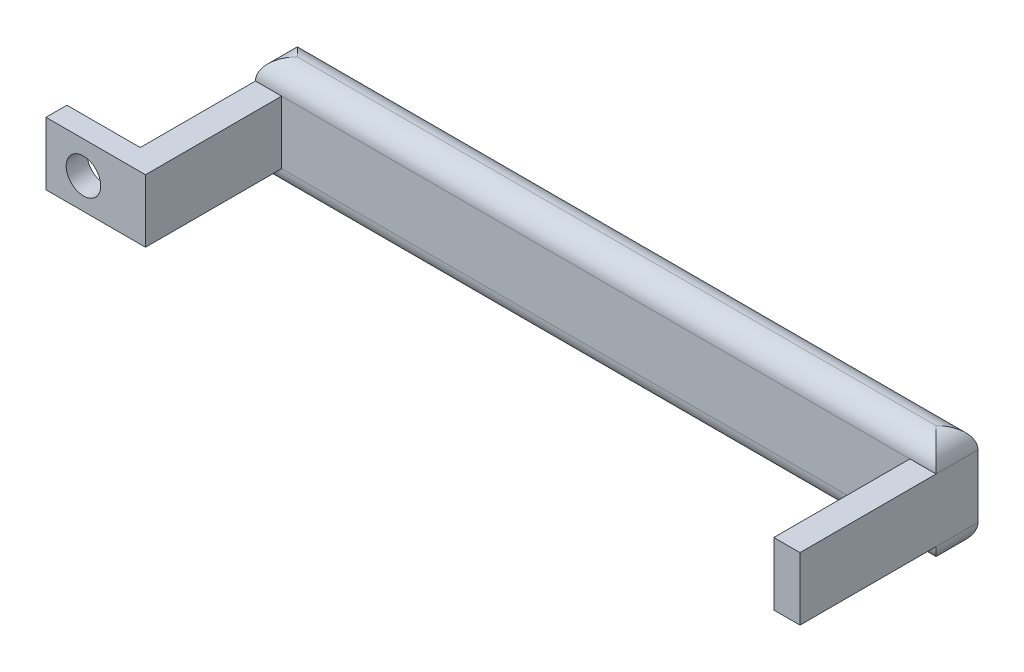
from build123d import *

# Parameters (mm, degrees)
ESQUISSE1_W        = 65
ESQUISSE1_H        = 10
BOSS_EXTRU_1_DEPTH = 4
CONG_1_R           = 2
ESQUISSE3_W        = 2.5
ESQUISSE3_H        = 6
BOSS_EXTRU_2_DEPTH = 13
ESQUISSE4_W        = 7
ESQUISSE4_H        = 6
ESQUISSE4_R        = 1.65
BOSS_EXTRU_3_DEPTH = 2


with BuildPart() as part:
    # Esquisse1 → Boss.-Extru.1 (new body)
    with BuildSketch(Plane.XY):
        with Locations((-5.559006211, 7.158385093)):
            Rectangle(ESQUISSE1_W, ESQUISSE1_H)
    extrude(amount=BOSS_EXTRU_1_DEPTH)

    # Congé1
    cong_1_edges = [part.edges().sort_by_distance(p)[0] for p in [
        (-5.559006211, 12.158385093, 4),
        (-5.559006211, 12.158385093, 0),
        (-5.559006211, 2.158385093, 0),
        (-38.059006211, 12.158385093, 2),
        (26.940993789, 12.158385093, 2),
        (26.940993789, 2.158385093, 2),
        (-38.059006211, 2.158385093, 2),
        (-5.559006211, 2.158385093, 4),
    ]]
    fillet(cong_1_edges, radius=CONG_1_R - 0.0001)  # a hair under: the kernel refuses the full size

    # Esquisse3 → Boss.-Extru.2 (add)
    with BuildSketch(Plane.XY.offset(4)):
        with Locations((-36.809006211, 7.158385093)):
            Rectangle(ESQUISSE3_W, ESQUISSE3_H)
        with Locations((25.690993789, 7.158385093)):
            Rectangle(ESQUISSE3_W, ESQUISSE3_H)
    extrude(amount=BOSS_EXTRU_2_DEPTH)

    # Esquisse4 → Boss.-Extru.3 (add)
    with BuildSketch(Plane.XY.offset(17)):
        with Locations((-41.559006211, 7.158385093)):
            Rectangle(ESQUISSE4_W, ESQUISSE4_H)
        with Locations((-41.482556552, 7.092856814)):
            Circle(ESQUISSE4_R, mode=Mode.SUBTRACT)
    extrude(amount=-BOSS_EXTRU_3_DEPTH)


solid = part.part
